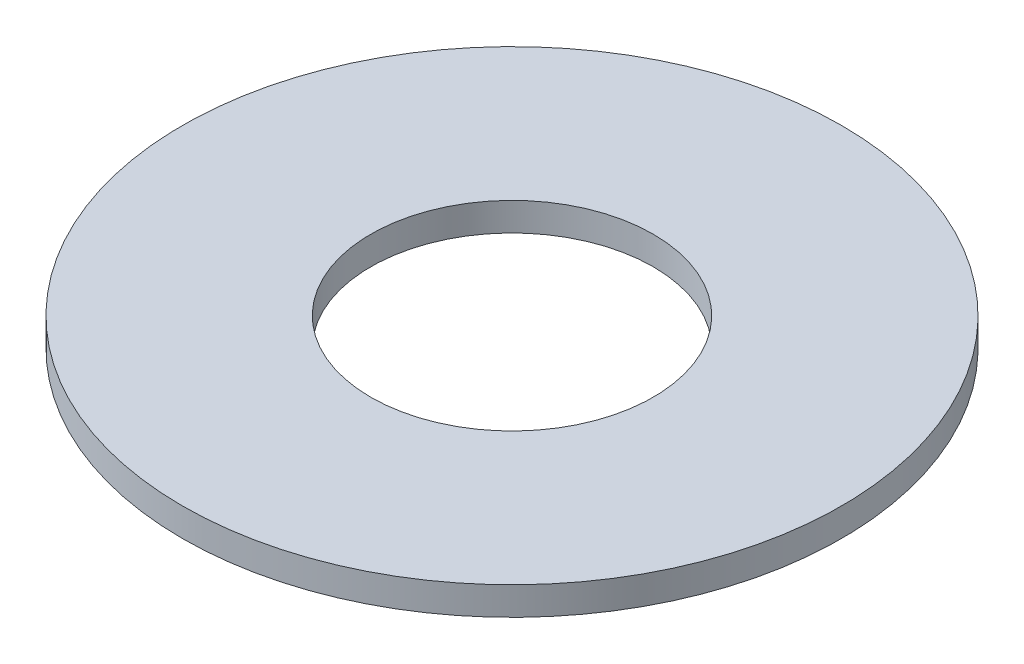
from build123d import *

# Parameters (mm, degrees)
SKETCH1_R           = 70
BOSS_EXTRUDE1_DEPTH = 6
SKETCH2_R           = 30
CUT_EXTRUDE1_DEPTH  = 100.176610146


with BuildPart() as part:
    # Sketch1 → Boss-Extrude1 (new body)
    with BuildSketch(Plane(origin=(0, 0, 0), x_dir=(1, 0, 0), z_dir=(0, 1, 0))):
        Circle(SKETCH1_R)
    extrude(amount=BOSS_EXTRUDE1_DEPTH)

    # Sketch2 → Cut-Extrude1 (cut, through all)
    with BuildSketch(Plane(origin=(0, 0, 0), x_dir=(1, 0, 0), z_dir=(0, 1, 0))):
        Circle(SKETCH2_R)
    extrude(amount=CUT_EXTRUDE1_DEPTH, mode=Mode.SUBTRACT)


solid = part.part
